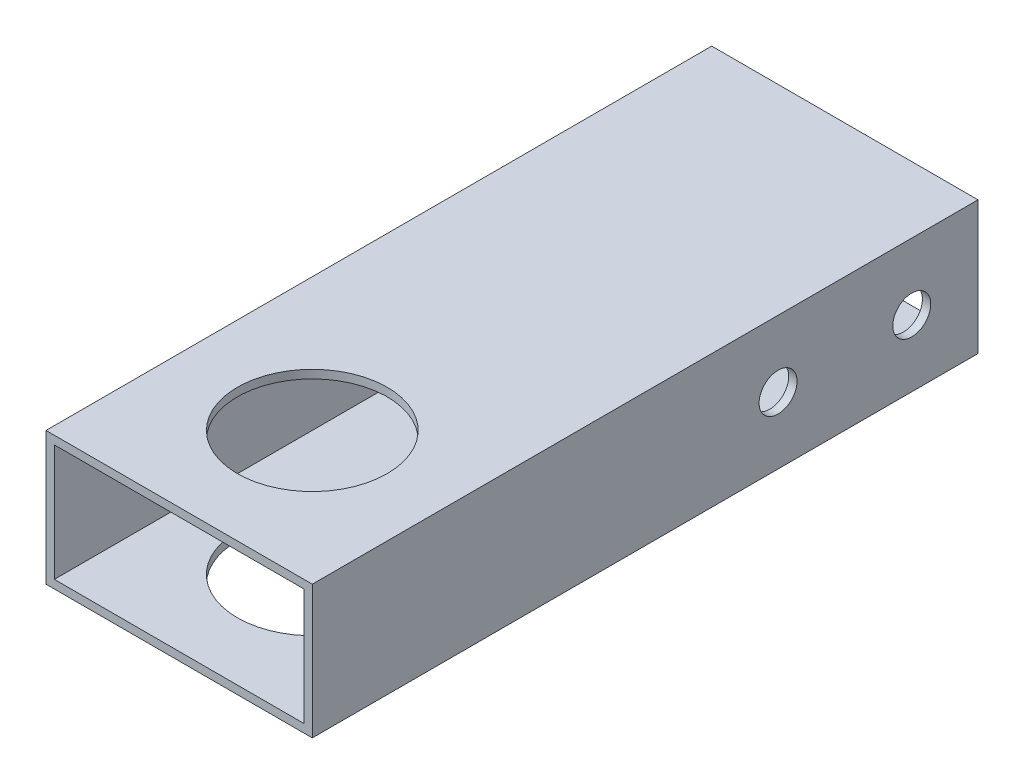
from build123d import *

# Parameters (mm, degrees)
SKETCH1_W               = 50.8
SKETCH1_H               = 25.4
SKETCH1_W_2             = 47.625
SKETCH1_H_2             = 22.225
BOSS_EXTRUDE1_DEPTH     = 127
SKETCH2_R               = 14.2875
CUT_EXTRUDE1_DEPTH      = 132.982271537
CUT_EXTRUDE2_DEPTH      = 138.371503595
CUT_EXTRUDE2_DEPTH_BACK = 138.371503595
SKETCH3_R               = 3.6195


with BuildPart() as part:
    # Sketch1 → Boss-Extrude1 (new body)
    with BuildSketch(Plane.XY):
        Rectangle(SKETCH1_W, SKETCH1_H)
        Rectangle(SKETCH1_W_2, SKETCH1_H_2, mode=Mode.SUBTRACT)
    extrude(amount=BOSS_EXTRUDE1_DEPTH)

    # Sketch2 → Cut-Extrude1 (cut, through all)
    with BuildSketch(Plane.XZ.offset(12.7)):
        with Locations((0, 101.6)):
            Circle(SKETCH2_R)
    extrude(amount=-CUT_EXTRUDE1_DEPTH, mode=Mode.SUBTRACT)

    # Sketch3 → Cut-Extrude2 (cut, two sides: drawn at the far end of the back side and taken through both)
    with BuildSketch(Plane(origin=(25.4, 0, 0), x_dir=(0, 0, -1), z_dir=(1, 0, 0)).offset(-CUT_EXTRUDE2_DEPTH_BACK)):
        with Locations((-12.6365, 0)):
            Circle(SKETCH3_R)
        with Locations((-38.1381, 0)):
            Circle(SKETCH3_R)
    extrude(amount=CUT_EXTRUDE2_DEPTH + CUT_EXTRUDE2_DEPTH_BACK, mode=Mode.SUBTRACT)


solid = part.part
